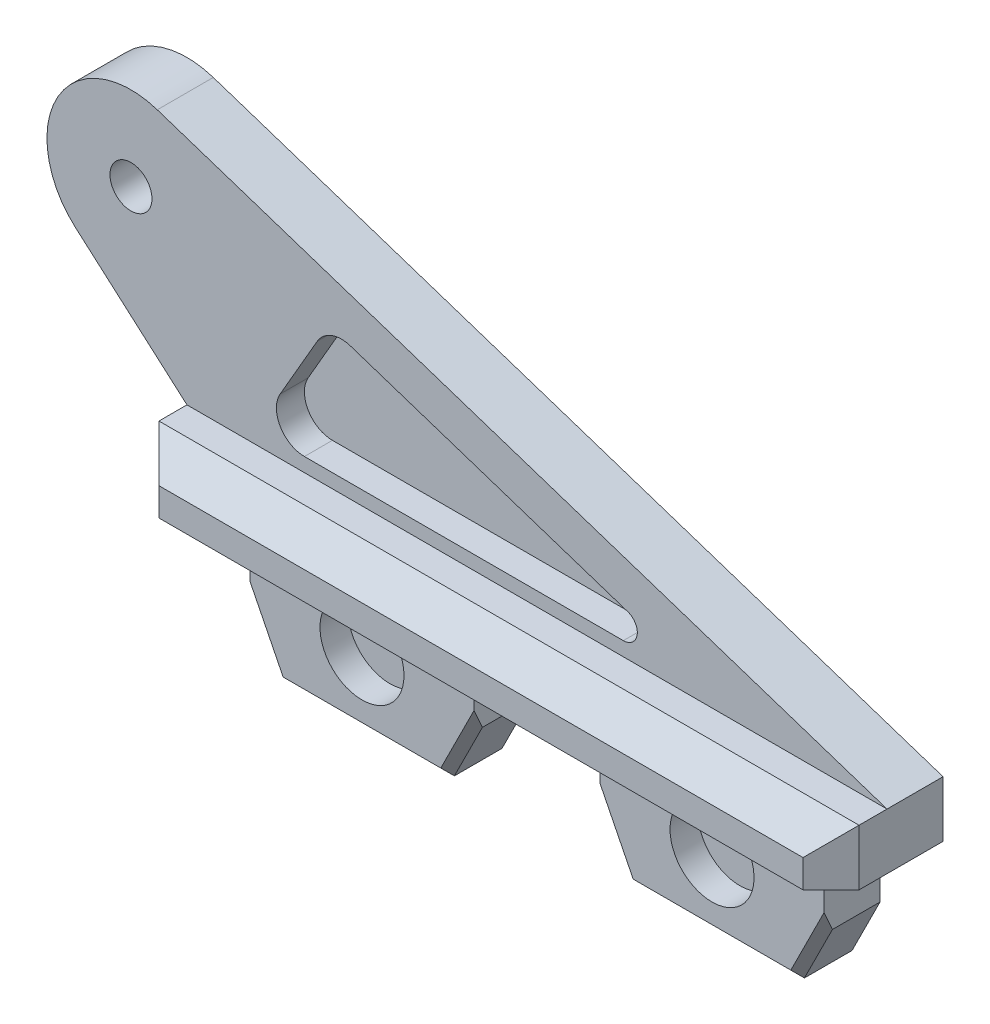
from build123d import *

# Parameters (mm, degrees)
SKIZZE1_R                       = 0.75
AUFSATZ_LINEAR_AUSTRAGEN1_DEPTH = 2
SKIZZE2_R                       = 1.5
SCHNITT_LINEAR_AUSTRAGEN1_DEPTH = 1
SKIZZE3_W                       = 25
SKIZZE3_H                       = 2
AUFSATZ_LINEAR_AUSTRAGEN2_DEPTH = 2
FASE1_SIZE                      = 1
SCHNITT_LINEAR_AUSTRAGEN2_DEPTH = 1
VERRUNDUNG1_R                   = 1
VERRUNDUNG2_R                   = 0.5
FASE2_SIZE                      = 0.3


with BuildPart() as part:
    # Skizze1 → Aufsatz-Linear austragen1 (new body)
    with BuildSketch(Plane.XY):
        with BuildLine():
            Line((9.25, -5), (3.25, -5))
            Line((3.25, -5), (2.25, -3))
            Line((2.25, -3), (2.25, 0))
            Line((2.25, 0), (0, 0))
            Line((0, 0), (0, 2))
            Line((0, 2), (-3.97861477, 5.490953701))
            ThreePointArc((-3.97861477, 5.490953701), (-4.604364731, 9.235021543), (-1.060351102, 10.595012138))
            Line((-1.060351102, 10.595012138), (25, 2))
            Line((25, 2), (25, 0))
            Line((25, 0), (22.75, 0))
            Line((22.75, 0), (22.75, -3))
            Line((22.75, -3), (21.75, -5))
            Line((21.75, -5), (15.75, -5))
            Line((15.75, -5), (14.75, -3))
            Line((14.75, -3), (14.75, 0))
            Line((14.75, 0), (10.25, 0))
            Line((10.25, 0), (10.25, -3))
            Line((10.25, -3), (9.25, -5))
        make_face()
        with Locations((-2, 7.745966692)):
            Circle(SKIZZE1_R, mode=Mode.SUBTRACT)
    extrude(amount=AUFSATZ_LINEAR_AUSTRAGEN1_DEPTH)

    # Skizze2 → Schnitt-Linear austragen1 (cut)
    with BuildSketch(Plane.XY.offset(2)):
        with Locations((6.25, -2.5)):
            Circle(SKIZZE2_R)
        with Locations((18.75, -2.5)):
            Circle(SKIZZE2_R)
    extrude(amount=-SCHNITT_LINEAR_AUSTRAGEN1_DEPTH, mode=Mode.SUBTRACT)

    # Skizze3 → Aufsatz-Linear austragen2 (add)
    with BuildSketch(Plane.XY.offset(2)):
        with Locations((12.5, 1)):
            Rectangle(SKIZZE3_W, SKIZZE3_H)
    extrude(amount=AUFSATZ_LINEAR_AUSTRAGEN2_DEPTH)

    # Fase1
    fase1_edges = [part.edges().sort_by_distance(p)[0] for p in [
        (25, 1, 4),
        (12.5, 2, 4),
        (0, 1, 4),
    ]]
    chamfer(fase1_edges, length=FASE1_SIZE)

    # Skizze4 → Schnitt-Linear austragen2 (cut)
    with BuildSketch(Plane.XY.offset(2)):
        Polygon((5.059080896, 6.997274675), (18.694961237, 2.5), (2.462578152, 2.5), align=None)
    extrude(amount=-SCHNITT_LINEAR_AUSTRAGEN2_DEPTH, mode=Mode.SUBTRACT)

    # Verrundung1
    verrundung1_edges = [part.edges().sort_by_distance(p)[0] for p in [
        (2.462578152, 2.5, 1.5),
        (5.059080896, 6.997274675, 1.5),
    ]]
    fillet(verrundung1_edges, radius=VERRUNDUNG1_R)

    # Verrundung2
    verrundung2_edges = [part.edges().sort_by_distance(p)[0] for p in [
        (18.694961237, 2.5, 1.5),
    ]]
    fillet(verrundung2_edges, radius=VERRUNDUNG2_R)

    # Fase2
    fase2_edges = [part.edges().sort_by_distance(p)[0] for p in [
        (22.25, -4, 2),
        (18.75, -5, 2),
        (15.25, -4, 2),
        (9.75, -4, 2),
        (6.25, -5, 2),
        (2.75, -4, 2),
    ]]
    chamfer(fase2_edges, length=FASE2_SIZE)


solid = part.part
